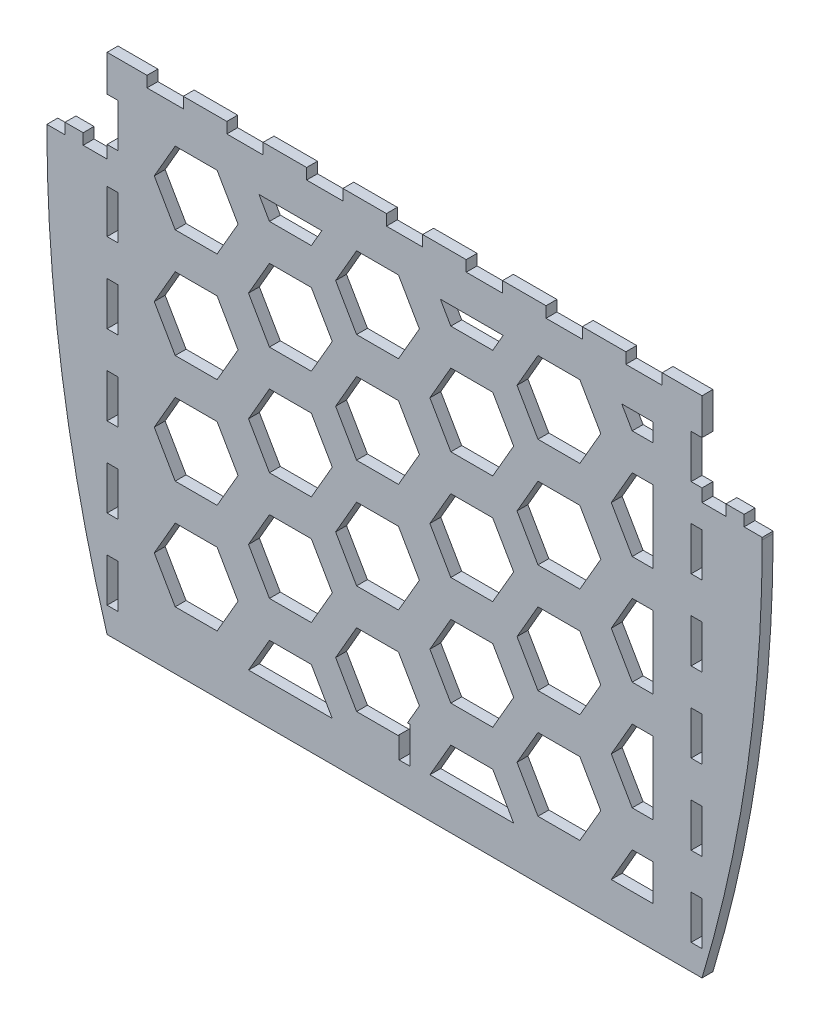
from build123d import *

# Parameters (mm, degrees)
BOSS_EXTRUDE1_DEPTH = 3
SKETCH2_W           = 10
SKETCH2_H           = 3
SKETCH2_W_2         = 3
SKETCH2_H_2         = 12
CUT_EXTRUDE1_DEPTH  = 10
CUT_EXTRUDE2_DEPTH  = 121.669838817
SKETCH5_W           = 3
SKETCH5_H           = 9.999999959
CUT_EXTRUDE3_DEPTH  = 10


with BuildPart() as part:
    # Sketch1 → Boss-Extrude1 (new body)
    with BuildSketch(Plane.XY.offset(152)):
        with BuildLine():
            Line((-82, 69.5), (82, 69.5))
            Line((82, 69.5), (82, 44))
            Line((82, 44), (88.6, 44))
            Line((88.6, 44), (88.6, 47))
            Line((88.6, 47), (93.6, 47))
            Line((93.6, 47), (93.6, 44))
            Line((93.6, 44), (98.6, 44))
            Line((98.6, 44), (98.6, 43.377104502))
            ThreePointArc((98.6, 43.377104502), (94.427800977, -13.668492876), (82, -69.5))
            Line((82, -69.5), (-82, -69.5))
            ThreePointArc((-82, -69.5), (-94.427800977, -13.668492876), (-98.6, 43.377104502))
            Line((-98.6, 43.377104502), (-98.6, 44))
            Line((-98.6, 44), (-93.6, 44))
            Line((-93.6, 44), (-93.6, 47))
            Line((-93.6, 47), (-88.6, 47))
            Line((-88.6, 47), (-88.6, 44))
            Line((-88.6, 44), (-82, 44))
            Line((-82, 44), (-82, 69.5))
        make_face()
    extrude(amount=BOSS_EXTRUDE1_DEPTH)

    # Sketch2 → Cut-Extrude1 (cut)
    with BuildSketch(Plane.XY.offset(155)):
        with Locations((0, 68)):
            Rectangle(SKETCH2_W, SKETCH2_H)
        with Locations((-22, 68)):
            Rectangle(SKETCH2_W, SKETCH2_H)
        with Locations((22, 68)):
            Rectangle(SKETCH2_W, SKETCH2_H)
        with Locations((-44, 68)):
            Rectangle(SKETCH2_W, SKETCH2_H)
        with Locations((44, 68)):
            Rectangle(SKETCH2_W, SKETCH2_H)
        with Locations((-66, 68)):
            Rectangle(SKETCH2_W, SKETCH2_H)
        with Locations((66, 68)):
            Rectangle(SKETCH2_W, SKETCH2_H)
        with Locations((-80.5, 53.5)):
            Rectangle(SKETCH2_W_2, SKETCH2_H_2)
        with Locations((80.5, 53.5)):
            Rectangle(SKETCH2_W_2, SKETCH2_H_2)
        with Locations((-80.5, 31.5)):
            Rectangle(SKETCH2_W_2, SKETCH2_H_2)
        with Locations((-80.5, 9.5)):
            Rectangle(SKETCH2_W_2, SKETCH2_H_2)
        with Locations((-80.5, -12.5)):
            Rectangle(SKETCH2_W_2, SKETCH2_H_2)
        with Locations((-80.5, -34.5)):
            Rectangle(SKETCH2_W_2, SKETCH2_H_2)
        with Locations((-80.5, -56.5)):
            Rectangle(SKETCH2_W_2, SKETCH2_H_2)
        with Locations((80.5, -56.5)):
            Rectangle(SKETCH2_W_2, SKETCH2_H_2)
        with Locations((80.5, -34.5)):
            Rectangle(SKETCH2_W_2, SKETCH2_H_2)
        with Locations((80.5, -12.5)):
            Rectangle(SKETCH2_W_2, SKETCH2_H_2)
        with Locations((80.5, 9.5)):
            Rectangle(SKETCH2_W_2, SKETCH2_H_2)
        with Locations((80.5, 31.5)):
            Rectangle(SKETCH2_W_2, SKETCH2_H_2)
    extrude(amount=-CUT_EXTRUDE1_DEPTH, mode=Mode.SUBTRACT)

    # Sketch3 → Cut-Extrude2 (cut, through all)
    with BuildSketch(Plane.XY.offset(155)):
        Polygon((-45.905989232, 46.5), (-51.679491924, 56.5), (-63.226497308, 56.5), (-69, 46.5), (-63.226497308, 36.5), (-51.679491924, 36.5), align=None)
        Polygon((-19.925227119, 31.5), (-25.698729811, 41.5), (-37.245735195, 41.5), (-43.019237886, 31.5), (-37.245735195, 21.5), (-25.698729811, 21.5), align=None)
        Polygon((4.094010768, 46.5), (-1.679491924, 56.5), (-13.226497308, 56.5), (-19, 46.5), (-13.226497308, 36.5), (-1.679491924, 36.5), align=None)
        Polygon((30.074772881, 31.5), (24.301270189, 41.5), (12.754264805, 41.5), (6.980762114, 31.5), (12.754264805, 21.5), (24.301270189, 21.5), align=None)
        Polygon((54.094010768, 46.5), (48.320508076, 56.5), (36.773502692, 56.5), (31, 46.5), (36.773502692, 36.5), (48.320508076, 36.5), align=None)
        Polygon((68.527767497, 41.5), (62.754264805, 41.5), (56.980762114, 31.5), (62.754264805, 21.5), (68.527767497, 21.5), align=None)
        Polygon((4.094010768, 16.5), (-1.679491924, 26.5), (-13.226497308, 26.5), (-19, 16.5), (-13.226497308, 6.5), (-1.679491924, 6.5), align=None)
        Polygon((30.074772881, 1.5), (24.301270189, 11.5), (12.754264805, 11.5), (6.980762114, 1.5), (12.754264805, -8.5), (24.301270189, -8.5), align=None)
        Polygon((54.094010768, 16.5), (48.320508076, 26.5), (36.773502692, 26.5), (31, 16.5), (36.773502692, 6.5), (48.320508076, 6.5), align=None)
        Polygon((68.527767497, 11.5), (62.754264805, 11.5), (56.980762114, 1.5), (62.754264805, -8.5), (68.527767497, -8.5), align=None)
        Polygon((4.094010768, -13.5), (-1.679491924, -3.5), (-13.226497308, -3.5), (-19, -13.5), (-13.226497308, -23.5), (-1.679491924, -23.5), align=None)
        Polygon((30.074772881, -28.5), (24.301270189, -18.5), (12.754264805, -18.5), (6.980762114, -28.5), (12.754264805, -38.5), (24.301270189, -38.5), align=None)
        Polygon((54.094010768, -13.5), (48.320508076, -3.5), (36.773502692, -3.5), (31, -13.5), (36.773502692, -23.5), (48.320508076, -23.5), align=None)
        Polygon((68.527767497, -18.5), (62.754264805, -18.5), (56.980762114, -28.5), (62.754264805, -38.5), (68.527767497, -38.5), align=None)
        Polygon((4.094010768, -43.5), (-1.679491924, -33.5), (-13.226497308, -33.5), (-19, -43.5), (-13.226497308, -53.5), (-1.679491924, -53.5), align=None)
        Polygon((30.074772881, -58.5), (24.301270189, -48.5), (12.754264805, -48.5), (6.980762114, -58.5), align=None)
        Polygon((54.094010768, -43.5), (48.320508076, -33.5), (36.773502692, -33.5), (31, -43.5), (36.773502692, -53.5), (48.320508076, -53.5), align=None)
        Polygon((68.527767497, -48.5), (62.754264805, -48.5), (56.980762114, -58.5), (68.527767497, -58.5), align=None)
        Polygon((-45.905989232, 16.5), (-51.679491924, 26.5), (-63.226497308, 26.5), (-69, 16.5), (-63.226497308, 6.5), (-51.679491924, 6.5), align=None)
        Polygon((-19.925227119, 1.5), (-25.698729811, 11.5), (-37.245735195, 11.5), (-43.019237886, 1.5), (-37.245735195, -8.5), (-25.698729811, -8.5), align=None)
        Polygon((-45.905989232, -13.5), (-51.679491924, -3.5), (-63.226497308, -3.5), (-69, -13.5), (-63.226497308, -23.5), (-51.679491924, -23.5), align=None)
        Polygon((-19.925227119, -28.5), (-25.698729811, -18.5), (-37.245735195, -18.5), (-43.019237886, -28.5), (-37.245735195, -38.5), (-25.698729811, -38.5), align=None)
        Polygon((-45.905989232, -43.5), (-51.679491924, -33.5), (-63.226497308, -33.5), (-69, -43.5), (-63.226497308, -53.5), (-51.679491924, -53.5), align=None)
        Polygon((-19.925227119, -58.5), (-25.698729811, -48.5), (-37.245735195, -48.5), (-43.019237886, -58.5), align=None)
        Polygon((-40.132486541, 56.5), (-37.245735195, 51.5), (-25.698729811, 51.5), (-22.811978465, 56.5), align=None)
        Polygon((24.301270189, 51.5), (27.188021535, 56.5), (9.867513459, 56.5), (12.754264805, 51.5), align=None)
        Polygon((59.867513459, 56.5), (68.527767497, 56.5), (68.527767497, 51.5), (62.754264805, 51.5), align=None)
    extrude(amount=-CUT_EXTRUDE2_DEPTH, mode=Mode.SUBTRACT)

    # Sketch5 → Cut-Extrude3 (cut)
    with BuildSketch(Plane.XY.offset(155)):
        with Locations((0, -54.193263087)):
            Rectangle(SKETCH5_W, SKETCH5_H)
    extrude(amount=-CUT_EXTRUDE3_DEPTH, mode=Mode.SUBTRACT)


solid = part.part
